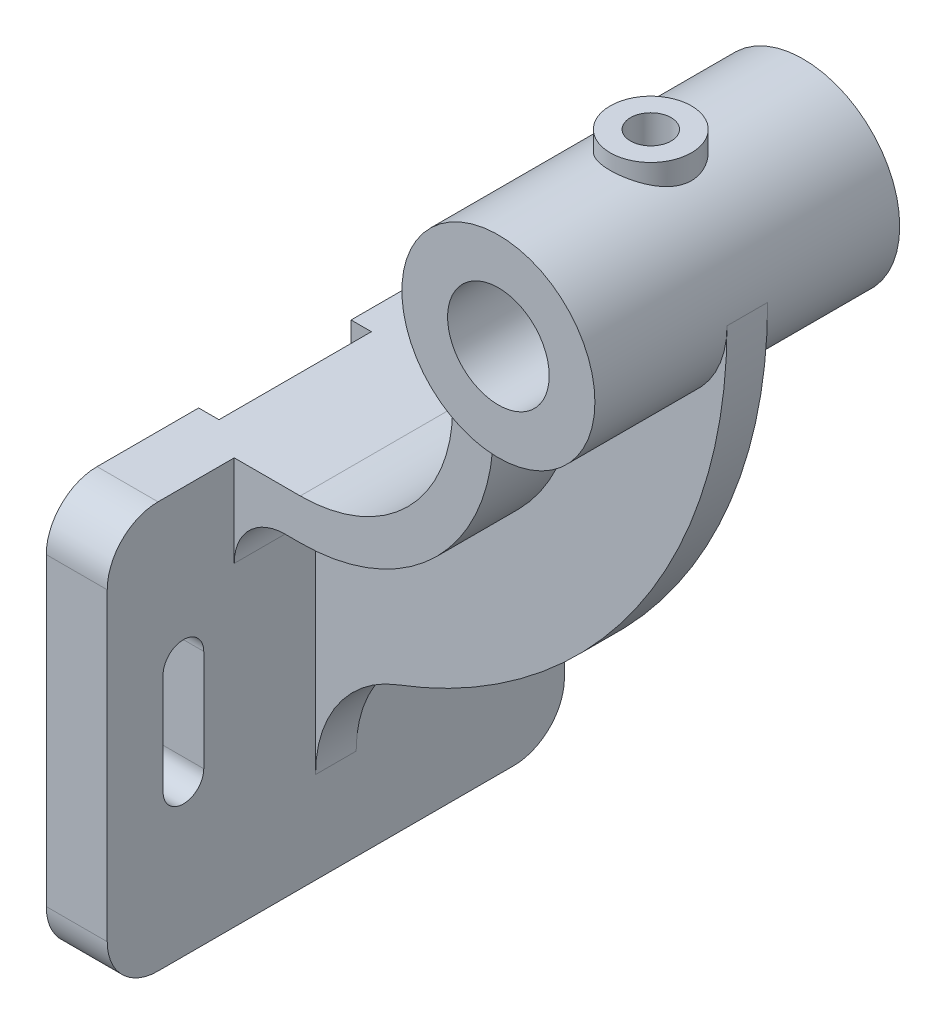
from build123d import *

# Parameters (mm, degrees)
SKETCH_1_R               = 19
EXTRUDE_1_DEPTH          = 30
SKETCH_2_R               = 8
EXTRUDE_2_DEPTH          = 22
SKETCH_3_R               = 10
CUT_EXTRUDE_1_DEPTH      = 67.670833355
CUT_EXTRUDE_2_REACH      = 56.24
CUT_EXTRUDE_2_END_RADIUS = 10
SKETCH_4_R               = 4
EXTRUDE_START            = -74
SKETCH_5_W               = 90
SKETCH_5_H               = 80
EXTRUDE_3_DEPTH          = 12
FILLET_1_R               = 10
SKETCH_6_W               = 30
SKETCH_6_H               = 80
CUT_EXTRUDE_3_DEPTH      = 4
CUT_EXTRUDE_4_DEPTH      = 164.740648637
EXTRUDE_4_DEPTH          = 4
EXTRUDE_5_DEPTH          = 20
FILLET_2_R               = 10


with BuildPart() as part:
    # 草图1 → 凸台-拉伸1 (new, symmetric)
    with BuildSketch(Plane.XY):
        Circle(SKETCH_1_R)
    extrude(amount=EXTRUDE_1_DEPTH, both=True)

    # 草图2 → 凸台-拉伸2 (add)
    with BuildSketch(Plane(origin=(0, 0, 0), x_dir=(1, 0, 0), z_dir=(0, 1, 0))):
        with Locations(Location((0, 0, 0), (0, 0, 90))):
            Circle(SKETCH_2_R)
    extrude(amount=EXTRUDE_2_DEPTH)

    # 草图3 → 切除-拉伸1 (cut, through all)
    with BuildSketch(Plane.XY.offset(30)):
        Circle(SKETCH_3_R)
    extrude(amount=-CUT_EXTRUDE_1_DEPTH, mode=Mode.SUBTRACT)

    # 切除-拉伸2: up to this cylinder (the profile starts outside it)
    cut_extrude_2_end = Plane(origin=(0, 0, 0), z_dir=(0, 0, 1)) * Cylinder(CUT_EXTRUDE_2_END_RADIUS, 133.48, mode=Mode.PRIVATE)
    # 草图4 → 切除-拉伸2 (cut, up to the surface)
    with BuildSketch(Plane(origin=(0, 22, 0), x_dir=(1, 0, 0), z_dir=(0, 1, 0)), mode=Mode.PRIVATE) as cut_extrude_2_sk1:
        with Locations(Location((0, 0, 0), (0, 0, 270))):
            Circle(SKETCH_4_R)
    cut_extrude_2_tool1 = extrude(cut_extrude_2_sk1.sketch, amount=-CUT_EXTRUDE_2_REACH, mode=Mode.PRIVATE) - cut_extrude_2_end
    add(cut_extrude_2_tool1.solids().sort_by_distance((0, 22, 0))[0], mode=Mode.SUBTRACT)



with BuildPart() as body_2:
    # 草图5 → 凸台-拉伸3 (new body)
    with BuildSketch(Plane(origin=(0, 0, 0), x_dir=(0, 0, -1), z_dir=(1, 0, 0)).offset(EXTRUDE_START)):
        with Locations((0, -95)):
            Rectangle(SKETCH_5_W, SKETCH_5_H)
    extrude(amount=EXTRUDE_3_DEPTH)

    # 圆角1
    fillet_1_edges = [body_2.edges().sort_by_distance(p)[0] for p in [
        (-68, -135, -45),
        (-68, -135, 45),
        (-68, -55, 45),
        (-68, -55, -45),
    ]]
    fillet(fillet_1_edges, radius=FILLET_1_R)

    # 草图6 → 切除-拉伸3 (cut)
    with BuildSketch(Plane.ZY.offset(74)):
        with Locations((0, -95)):
            Rectangle(SKETCH_6_W, SKETCH_6_H)
    extrude(amount=-CUT_EXTRUDE_3_DEPTH, mode=Mode.SUBTRACT)

    # 草图7 → 切除-拉伸4 (cut, through all)
    with BuildSketch(Plane(origin=(-62, 0, 0), x_dir=(0, 0, -1), z_dir=(1, 0, 0))):
        with BuildLine():
            Line((-26, -85), (-26, -105))
            ThreePointArc((-26, -105), (-30, -109), (-34, -105))
            Line((-34, -105), (-34, -85))
            ThreePointArc((-34, -85), (-30, -81), (-26, -85))
        make_face()
    cut_extrude_4 = extrude(amount=-CUT_EXTRUDE_4_DEPTH, mode=Mode.SUBTRACT)

    # 镜向1: 切除-拉伸4 across plane
    add(cut_extrude_4.mirror(Plane.XY), mode=Mode.SUBTRACT)


with BuildPart() as part_1:
    add(part.part)

    add(body_2.part)  # 凸台-拉伸4 merges body 2
    # 草图8 → 凸台-拉伸4 (add, symmetric)
    with BuildSketch(Plane.XY):
        with BuildLine():
            Line((-19, 0), (-19, -25))
            ThreePointArc((-19, -25), (-27.786796564, -46.213203436), (-49, -55))
            Line((-49, -55), (-62, -55))
            Line((-62, -55), (-62, -117))
            ThreePointArc((-62, -117), (-57.554804791, -102.769750529), (-45.8, -93.6))
            ThreePointArc((-45.8, -93.6), (1.219219164, -56.920997883), (19, 0))
            ThreePointArc((19, 0), (0, -19), (-19, 0))
        make_face()
    extrude(amount=EXTRUDE_4_DEPTH, both=True)

    # 草图9 → 凸台-拉伸5 (add, symmetric)
    with BuildSketch(Plane.XY):
        with BuildLine():
            Line((-49, -55), (-62, -55))
            Line((-62, -55), (-62, -73))
            ThreePointArc((-62, -73), (-59.071067812, -65.928932188), (-52, -63))
            Line((-52, -63), (-49, -63))
            ThreePointArc((-49, -63), (-22.129942315, -51.870057685), (-11, -25))
            Line((-11, -25), (-11, -15.491933385))
            ThreePointArc((-11, -15.491933385), (-16.881943016, -8.717797887), (-19, 0))
            Line((-19, 0), (-19, -25))
            ThreePointArc((-19, -25), (-27.786796564, -46.213203436), (-49, -55))
        make_face()
    extrude(amount=EXTRUDE_5_DEPTH, both=True)

    # 圆角2
    # the kernel refuses this fillet: 10 mm, written as the material it adds along each edge
    with BuildSketch(Plane(origin=(-11, -15.491933385, -20), x_dir=(0.9464272027660603, -0.32291724925189497, 0), z_dir=(0, 0, 1))) as fillet_2_piece_1_section:
        with BuildLine():
            CenterArc((13.662534862, -9.586356274), FILLET_2_R, 106.537100336, 87.550188329)
            Line((3.963274477, -12.020354626), (2.993348438, -12.263754461))
            ThreePointArc((2.993348438, -12.263754461), (2.123891514, -9.32161014), (-0.946427203, -0.322917249))
            Line((-0.946427203, -0.322917249), (0.284636143, 0.958635627))
            ThreePointArc((0.284636143, 0.958635627), (5.408086716, 0.214076921), (10.531537289, 0.958635627))
            Line((10.531537289, 0.958635627), (10.816173432, 0))
        make_face()
    fillet_2_piece_1 = extrude(amount=47.642186032, mode=Mode.PRIVATE)
    fillet_2_piece_1 = split(fillet_2_piece_1, bisect_by=Plane(origin=(-8.746000777, -19.792422089, 20), z_dir=(0, 0, -1)), keep=Keep.TOP, mode=Mode.PRIVATE)
    add(fillet_2_piece_1)
    with BuildSketch(Plane(origin=(-11, -15.491933385, -27.642186032), x_dir=(0.9464272027660603, -0.32291724925189513, 0), z_dir=(0, 0, 1))) as fillet_2_piece_2_section:
        with BuildLine():
            CenterArc((13.662534862, -9.586356274), FILLET_2_R, 106.537100336, 87.550188329)
            Line((3.963274477, -12.020354626), (2.993348438, -12.263754461))
            ThreePointArc((2.993348438, -12.263754461), (2.123891514, -9.32161014), (-0.946427203, -0.322917249))
            Line((-0.946427203, -0.322917249), (0.284636143, 0.958635627))
            ThreePointArc((0.284636143, 0.958635627), (5.408086716, 0.214076921), (10.531537289, 0.958635627))
            Line((10.531537289, 0.958635627), (10.816173432, 0))
        make_face()
    fillet_2_piece_2 = extrude(amount=47.642186032, mode=Mode.PRIVATE)
    fillet_2_piece_2 = split(fillet_2_piece_2, bisect_by=Plane(origin=(-8.746000777, -19.792422089, -20), z_dir=(0, 0, 1)), keep=Keep.TOP, mode=Mode.PRIVATE)
    add(fillet_2_piece_2)


solid = part_1.part
